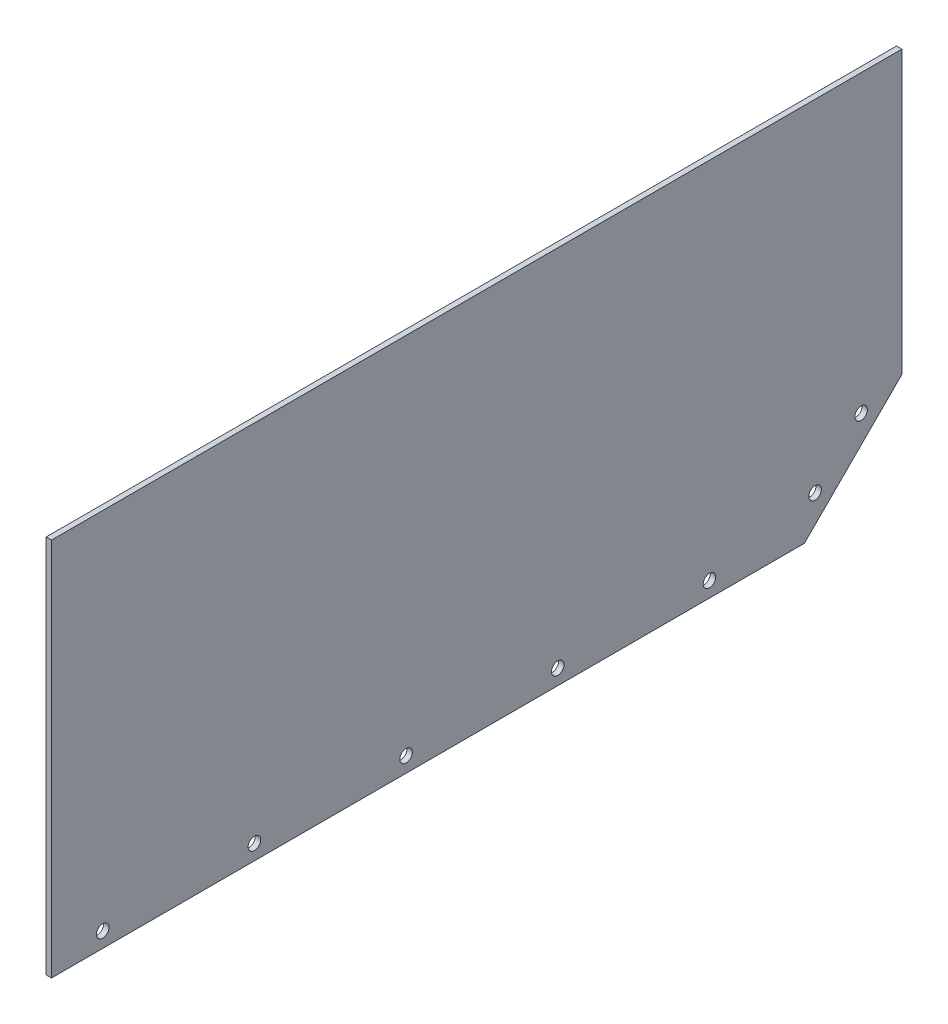
from build123d import *

# Parameters (mm, degrees)
SKETCH1_W           = 498.348
SKETCH1_H           = 165.1
BOSS_EXTRUDE1_DEPTH = 1.5875
BOSS_EXTRUDE2_DEPTH = 3.175
SKETCH3_R           = 3.675
CUT_EXTRUDE1_DEPTH  = 3.175
LPATTERN1_COUNT     = 5
LPATTERN1_PITCH     = 88.9
CUT_EXTRUDE2_DEPTH  = 286.681383539
LPATTERN2_COUNT     = 2
LPATTERN2_PITCH     = 38.1


with BuildPart() as part:
    # Sketch1 → Boss-Extrude1 (new, symmetric)
    with BuildSketch(Plane(origin=(0, 0, 0), x_dir=(0, 0, -1), z_dir=(1, 0, 0))):
        Rectangle(SKETCH1_W, SKETCH1_H)
    extrude(amount=BOSS_EXTRUDE1_DEPTH, both=True)

    # Sketch2 → Boss-Extrude2 (add)
    with BuildSketch(Plane(origin=(1.5875, 0, 0), x_dir=(0, 0, -1), z_dir=(1, 0, 0))):
        Polygon((-249.174, -139.7), (192.024, -139.7), (249.174, -82.55), (-249.174, -82.55), align=None)
    extrude(amount=-BOSS_EXTRUDE2_DEPTH)

    # Sketch3 → Cut-Extrude1 (cut)
    with BuildSketch(Plane(origin=(1.5875, 0, 0), x_dir=(0, 0, -1), z_dir=(1, 0, 0))):
        with Locations((-219.202, -130.81)):
            Circle(SKETCH3_R)
    cut_extrude1 = extrude(amount=-CUT_EXTRUDE1_DEPTH, mode=Mode.SUBTRACT)

    # LPattern1: Cut-Extrude1 ×5
    with Locations(*[(0, 0, -i * LPATTERN1_PITCH) for i in range(1, LPATTERN1_COUNT)]):
        add(cut_extrude1, mode=Mode.SUBTRACT)

    # Sketch4 → Cut-Extrude2 (cut, through all)
    with BuildSketch(Plane(origin=(1.5875, 0, 0), x_dir=(0, 0, -1), z_dir=(1, 0, 0))):
        with BuildLine():
            ThreePointArc((195.711561864, -119.847977118), (199.716540899, -120.644616979), (201.985179285, -117.249359697))
            ThreePointArc((201.985179285, -117.249359697), (196.903817671, -113.854102415), (195.711561864, -119.847977118))
        make_face()
    cut_extrude2 = extrude(amount=-CUT_EXTRUDE2_DEPTH, mode=Mode.SUBTRACT)

    # LPattern2: Cut-Extrude2 ×2
    with Locations(*[Vector(0, 0.7071067811865489, -0.7071067811865461) * (i * LPATTERN2_PITCH) for i in range(1, LPATTERN2_COUNT)]):
        add(cut_extrude2, mode=Mode.SUBTRACT)


solid = part.part
